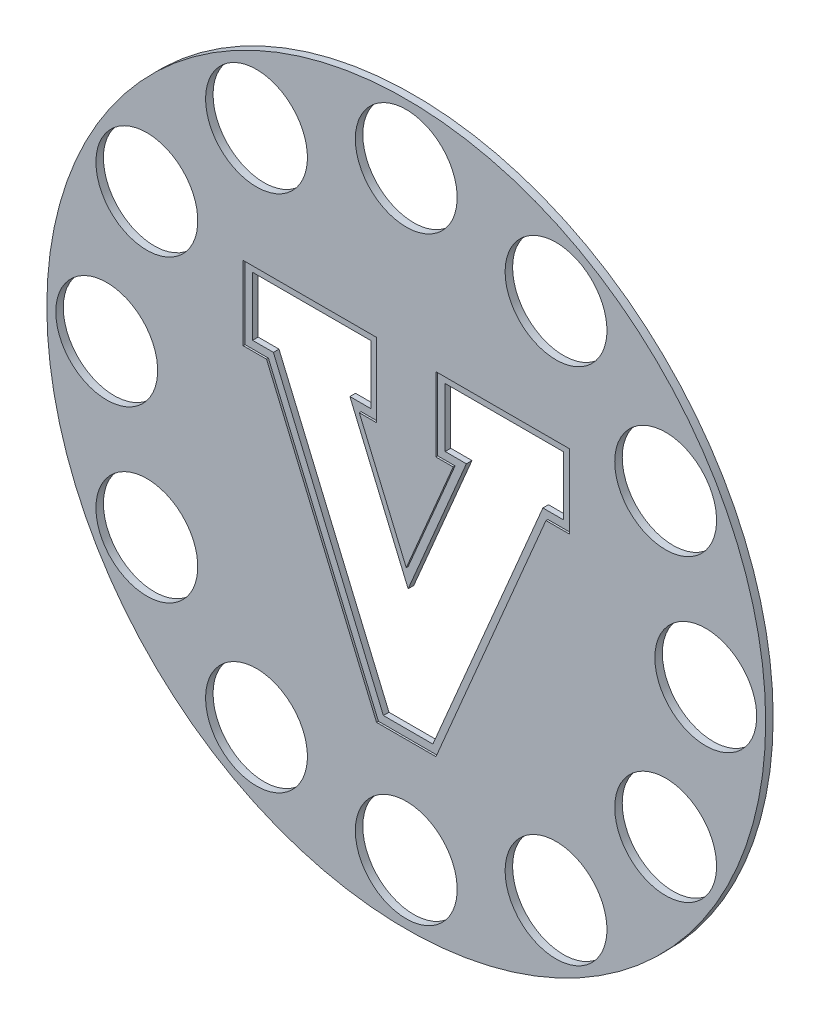
from build123d import *

# Parameters (mm, degrees)
SKETCH1_R               = 609.6
SKETCH1_R_2             = 86.36
BOSS_EXTRUDE1_DEPTH     = 12.7
CUT_EXTRUDE1_DEPTH      = 863.198126883
CUT_EXTRUDE1_DEPTH_BACK = 3.175


with BuildPart() as part:
    # Sketch1 → Boss-Extrude1 (new body)
    with BuildSketch(Plane.XY):
        Circle(SKETCH1_R)
        with Locations((0, 508)):
            Circle(SKETCH1_R_2, mode=Mode.SUBTRACT)
        with Locations((254, 439.940905122)):
            Circle(SKETCH1_R_2, mode=Mode.SUBTRACT)
        with Locations((439.940905123, 254)):
            Circle(SKETCH1_R_2, mode=Mode.SUBTRACT)
        with Locations((508, 0)):
            Circle(SKETCH1_R_2, mode=Mode.SUBTRACT)
        with Locations((439.940905123, -254)):
            Circle(SKETCH1_R_2, mode=Mode.SUBTRACT)
        with Locations((254, -439.940905122)):
            Circle(SKETCH1_R_2, mode=Mode.SUBTRACT)
        with Locations((0, -508)):
            Circle(SKETCH1_R_2, mode=Mode.SUBTRACT)
        with Locations((-254, -439.940905123)):
            Circle(SKETCH1_R_2, mode=Mode.SUBTRACT)
        with Locations((-439.940905122, -254)):
            Circle(SKETCH1_R_2, mode=Mode.SUBTRACT)
        with Locations((-508, 0)):
            Circle(SKETCH1_R_2, mode=Mode.SUBTRACT)
        with Locations((-439.940905122, 254)):
            Circle(SKETCH1_R_2, mode=Mode.SUBTRACT)
        with Locations((-254, 439.940905122)):
            Circle(SKETCH1_R_2, mode=Mode.SUBTRACT)
        Polygon((-263.817141205, 221.767857965), (-62.758262665, 221.767857965), (-62.758262665, 121.81951372), (-98.786154196, 121.81951372), (0, -111.199591177), (98.786154196, 121.81951372), (62.758262665, 121.81951372), (62.758262665, 221.767857965), (263.817141205, 221.767857965), (263.817141205, 121.81951372), (228.547895375, 121.81951372), (41.969279032, -318.286516595), (-41.969279032, -318.286516595), (-228.547895375, 121.81951372), (-263.817141205, 121.81951372), align=None, mode=Mode.SUBTRACT)
    extrude(amount=BOSS_EXTRUDE1_DEPTH)

    # Sketch2 → Cut-Extrude1 (cut, two sides: drawn at the far end of the back side and taken through both)
    with BuildSketch(Plane.XY.offset(12.7).offset(-CUT_EXTRUDE1_DEPTH_BACK)):
        Polygon((0, -78.661684463), (-79.607989254, 109.11951372), (-50.058262665, 109.11951372), (-50.058262665, 234.467857965), (-276.517141205, 234.467857965), (-276.517141205, 109.11951372), (-236.957980515, 109.11951372), (-50.379364172, -330.986516595), (50.379364172, -330.986516595), (236.957980515, 109.11951372), (276.517141205, 109.11951372), (276.517141205, 234.467857965), (50.058262665, 234.467857965), (50.058262665, 109.11951372), (79.607989254, 109.11951372), align=None)
        Polygon((0, -111.199591177), (98.786154196, 121.81951372), (62.758262665, 121.81951372), (62.758262665, 221.767857965), (263.817141205, 221.767857965), (263.817141205, 121.81951372), (228.547895375, 121.81951372), (41.969279032, -318.286516595), (-41.969279032, -318.286516595), (-228.547895375, 121.81951372), (-263.817141205, 121.81951372), (-263.817141205, 221.767857965), (-62.758262665, 221.767857965), (-62.758262665, 121.81951372), (-98.786154196, 121.81951372), align=None, mode=Mode.SUBTRACT)
    extrude(amount=CUT_EXTRUDE1_DEPTH + CUT_EXTRUDE1_DEPTH_BACK, mode=Mode.SUBTRACT)


solid = part.part
